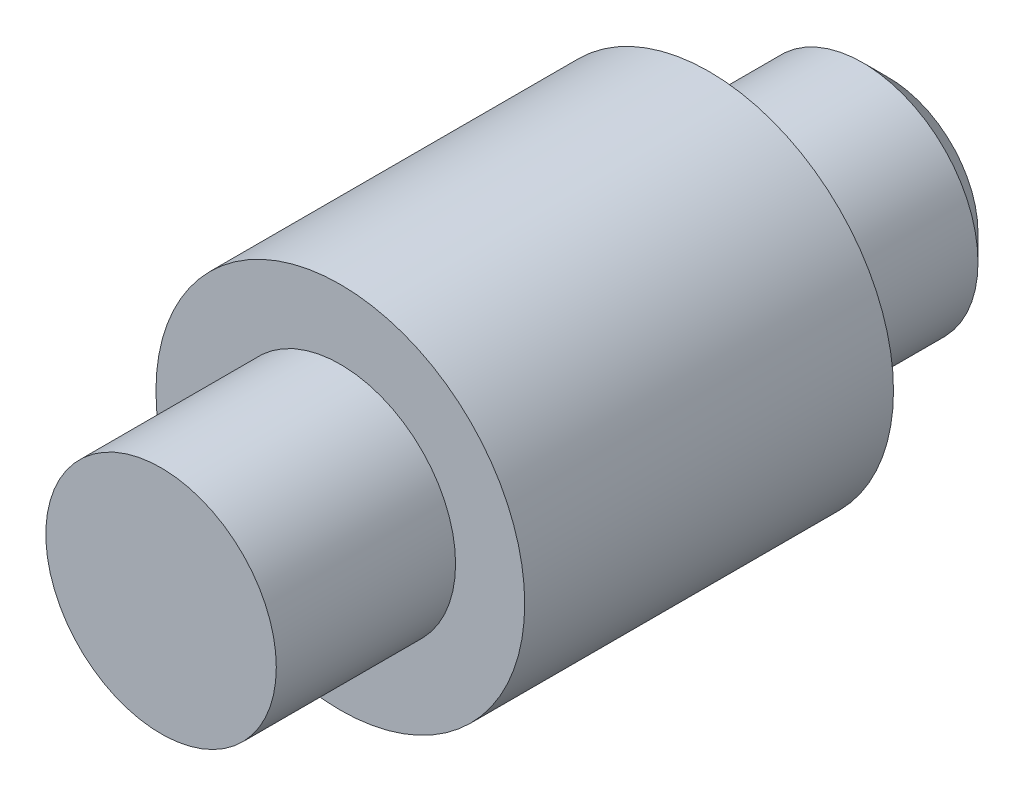
from build123d import *

# Parameters (mm, degrees)
SKETCH3_R           = 3.6
BOSS_EXTRUDE1_DEPTH = 7.2
SKETCH4_R           = 2.25
BOSS_EXTRUDE2_DEPTH = 3.5
BOSS_EXTRUDE3_START = 3.5
SKETCH5_R           = 2.25
BOSS_EXTRUDE3_DEPTH = 3.5
CHAMFER1_SIZE       = 0.5


with BuildPart() as part:
    # Sketch3 → Boss-Extrude1 (new body)
    with BuildSketch(Plane.XY):
        Circle(SKETCH3_R)
    extrude(amount=BOSS_EXTRUDE1_DEPTH)

    # Sketch4 → Boss-Extrude2 (add)
    with BuildSketch(Plane.XY):
        Circle(SKETCH4_R)
    extrude(amount=-BOSS_EXTRUDE2_DEPTH)

    # Sketch5 → Boss-Extrude3 (add)
    with BuildSketch(Plane.XY.offset(7.2).offset(BOSS_EXTRUDE3_START)):
        Circle(SKETCH5_R)
    extrude(amount=-BOSS_EXTRUDE3_DEPTH)

    # Chamfer1
    chamfer1_edges = [part.edges().sort_by_distance(p)[0] for p in [
        (-2.25, 0, -3.5),
    ]]
    chamfer(chamfer1_edges, length=CHAMFER1_SIZE)


solid = part.part
